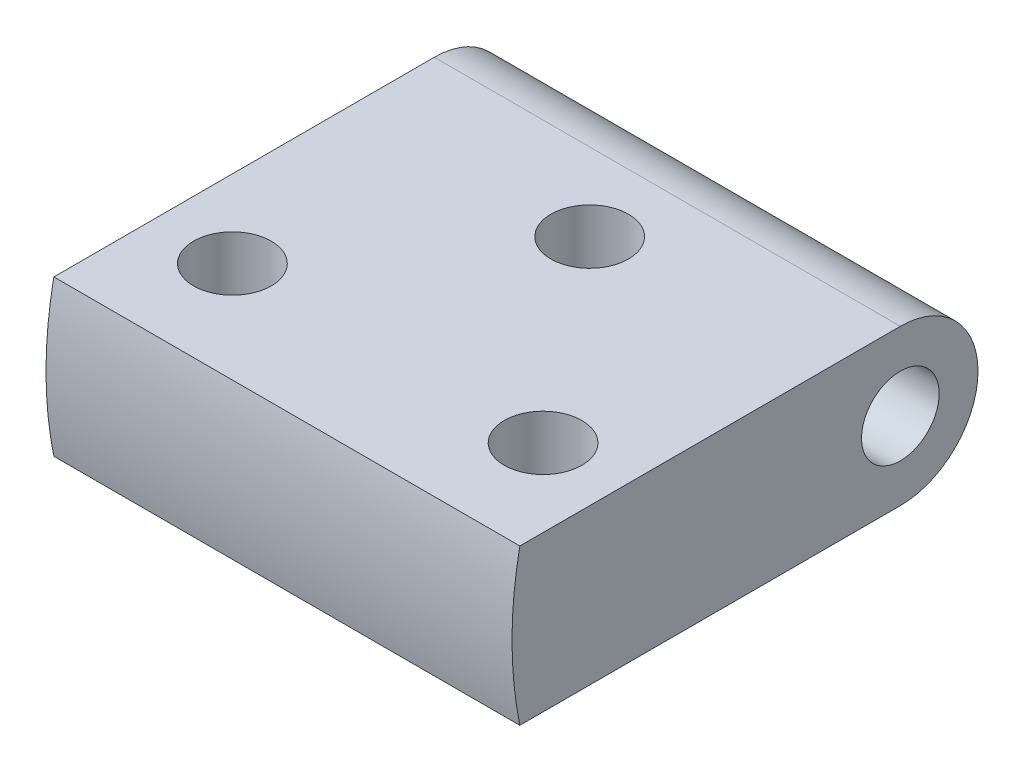
from build123d import *

# Parameters (mm, degrees)
SKETCH1_W                               = 30
SKETCH1_H                               = 30
BOSS_EXTRUDE1_DEPTH                     = 10
FILLET1_R                               = 5
CBORE_FOR_M5_HEX_HEAD_BOLT2_D           = 4.5
CBORE_FOR_M5_HEX_HEAD_BOLT2_CBORE_D     = 5
CBORE_FOR_M5_HEX_HEAD_BOLT2_CBORE_DEPTH = 4.2
CBORE_FOR_M5_HEX_HEAD_BOLT1_D           = 4.5
CBORE_FOR_M5_HEX_HEAD_BOLT1_CBORE_D     = 5
CBORE_FOR_M5_HEX_HEAD_BOLT1_CBORE_DEPTH = 4.2
CUT_EXTRUDE1_DEPTH                      = 36


with BuildPart() as part:
    # Sketch1 → Boss-Extrude1 (new body)
    with BuildSketch(Plane(origin=(0, 0, 0), x_dir=(1, 0, 0), z_dir=(0, 1, 0))):
        Rectangle(SKETCH1_W, SKETCH1_H)
    extrude(amount=BOSS_EXTRUDE1_DEPTH)

    # Fillet1
    fillet1_edges = [part.edges().sort_by_distance(p)[0] for p in [
        (0, 0, -15),
        (0, 10, -15),
    ]]
    fillet(fillet1_edges, radius=FILLET1_R - 0.0001)  # a hair under: the kernel refuses the full size

    # CBORE for M5 Hex Head Bolt2 (through all)
    with Locations(Plane(origin=(15, 0, 0), x_dir=(0, 0, -1), z_dir=(1, 0, 0))):
        with Locations((10, 5)):
            cbore_for_m5_hex_head_bolt2 = CounterBoreHole(CBORE_FOR_M5_HEX_HEAD_BOLT2_D / 2, CBORE_FOR_M5_HEX_HEAD_BOLT2_CBORE_D / 2, CBORE_FOR_M5_HEX_HEAD_BOLT2_CBORE_DEPTH)

    # CBORE for M5 Hex Head Bolt1 (through all)
    with Locations(Plane(origin=(0, 10, 0), x_dir=(1, 0, 0), z_dir=(0, 1, 0))):
        with Locations((-10, -8), (10, -8), (0, 5)):
            CounterBoreHole(CBORE_FOR_M5_HEX_HEAD_BOLT1_D / 2, CBORE_FOR_M5_HEX_HEAD_BOLT1_CBORE_D / 2, CBORE_FOR_M5_HEX_HEAD_BOLT1_CBORE_DEPTH)

    # Sketch9 → Cut-Extrude1 (cut, through all)
    with BuildSketch(Plane(origin=(15, 0, 0), x_dir=(0, 0, -1), z_dir=(1, 0, 0))):
        with BuildLine():
            Line((-15, 10), (-15, 5))
            ThreePointArc((-15, 5), (-14.873403825, 7.51272405), (-14.494897428, 10))
            Line((-14.494897428, 10), (-15, 10))
        make_face()
        with BuildLine():
            Line((-15, 0), (-14.494897428, 0))
            ThreePointArc((-14.494897428, 0), (-14.873403825, 2.48727595), (-15, 5))
            Line((-15, 5), (-15, 0))
        make_face()
    extrude(amount=-CUT_EXTRUDE1_DEPTH, mode=Mode.SUBTRACT)

    # Mirror1: CBORE for M5 Hex Head Bolt2 across plane
    add(cbore_for_m5_hex_head_bolt2.mirror(Plane(origin=(0, 0, 0), x_dir=(0, 0, 1), z_dir=(1, 0, 0))), mode=Mode.SUBTRACT)


solid = part.part
